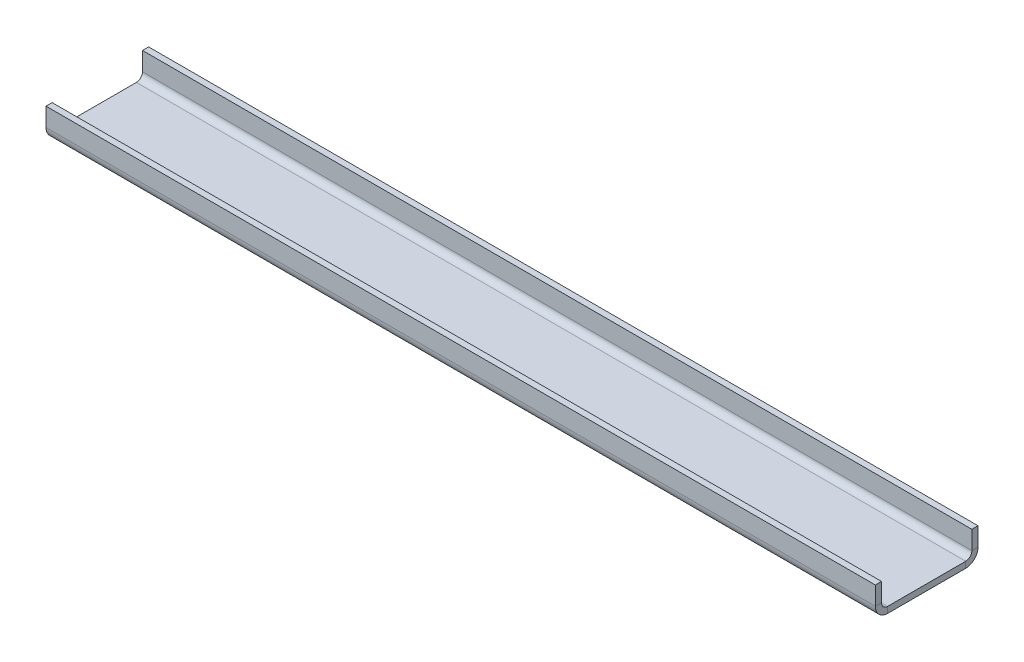
from build123d import *

# Parameters (mm, degrees)
ESQUISSE2_W                             = 404
ESQUISSE2_H                             = 50
T_LE_DE_BASE_PLI_E1_DEPTH               = 3
T_LE_PLI_E_SUR_AR_TE1_STRIP_W           = 18
T_LE_PLI_E_SUR_AR_TE1_STRIP_H           = 3
T_LE_PLI_E_SUR_AR_TE1_STRIP_CUT_DEPTH   = 404
T_LE_PLI_E_SUR_AR_TE1_STRIP_2_W         = 18
T_LE_PLI_E_SUR_AR_TE1_STRIP_2_H         = 3
T_LE_PLI_E_SUR_AR_TE1_STRIP_CUT_2_DEPTH = 404
T_LE_PLI_E_SUR_AR_TE1_DEPTH             = 404
T_LE_PLI_E_SUR_AR_TE1_BEND_DEPTH        = 404


# Sheet-metal steps are written as plain solids
with BuildPart() as part:
    # Esquisse2 → Tôle de base pliée1 (new body)
    with BuildSketch(Plane(origin=(0, 0, 0), x_dir=(1, 0, 0), z_dir=(0, 1, 0))):
        with Locations((202, 25)):
            Rectangle(ESQUISSE2_W, ESQUISSE2_H)
    extrude(amount=-T_LE_DE_BASE_PLI_E1_DEPTH)

    # Tôle pliée sur arête1 strip (across the edge) → Tôle pliée sur arête1 strip cut (cut)
    with BuildSketch(Plane(origin=(0, 0, 0), x_dir=(0, 0, -1), z_dir=(1, 0, 0))):
        with Locations((-3, -1.5)):
            Rectangle(T_LE_PLI_E_SUR_AR_TE1_STRIP_W, T_LE_PLI_E_SUR_AR_TE1_STRIP_H)
    extrude(amount=T_LE_PLI_E_SUR_AR_TE1_STRIP_CUT_DEPTH, mode=Mode.SUBTRACT)

    # Tôle pliée sur arête1 strip 2 (across the edge) → Tôle pliée sur arête1 strip cut 2 (cut)
    with BuildSketch(Plane(origin=(404, 0, -50), x_dir=(0, 0, 1), z_dir=(-1, 0, 0))):
        with Locations((-3, -1.5)):
            Rectangle(T_LE_PLI_E_SUR_AR_TE1_STRIP_2_W, T_LE_PLI_E_SUR_AR_TE1_STRIP_2_H)
    extrude(amount=T_LE_PLI_E_SUR_AR_TE1_STRIP_CUT_2_DEPTH, mode=Mode.SUBTRACT)

    # Tôle pliée sur arête1 section (across the edge) → Tôle pliée sur arête1 (add)
    with BuildSketch(Plane(origin=(0, 0, 0), x_dir=(0, 0, -1), z_dir=(1, 0, 0))):
        with BuildLine():
            Line((0, 3), (0, 12))
            Line((0, 12), (3, 12))
            Line((3, 12), (3, 3))
            ThreePointArc((3, 3), (3.878679656, 0.878679656), (6, 0))
            Line((6, 0), (6, -3))
            ThreePointArc((6, -3), (1.757359313, -1.242640687), (0, 3))
        make_face()
    extrude(amount=T_LE_PLI_E_SUR_AR_TE1_DEPTH)

    # Tôle pliée sur arête1 section 2 (across the edge) → Tôle pliée sur arête1 bend (add)
    with BuildSketch(Plane(origin=(404, 0, -50), x_dir=(0, 0, 1), z_dir=(-1, 0, 0))):
        with BuildLine():
            Line((0, 3), (0, 12))
            Line((0, 12), (3, 12))
            Line((3, 12), (3, 3))
            ThreePointArc((3, 3), (3.878679656, 0.878679656), (6, 0))
            Line((6, 0), (6, -3))
            ThreePointArc((6, -3), (1.757359313, -1.242640687), (0, 3))
        make_face()
    extrude(amount=T_LE_PLI_E_SUR_AR_TE1_BEND_DEPTH)


solid = part.part
